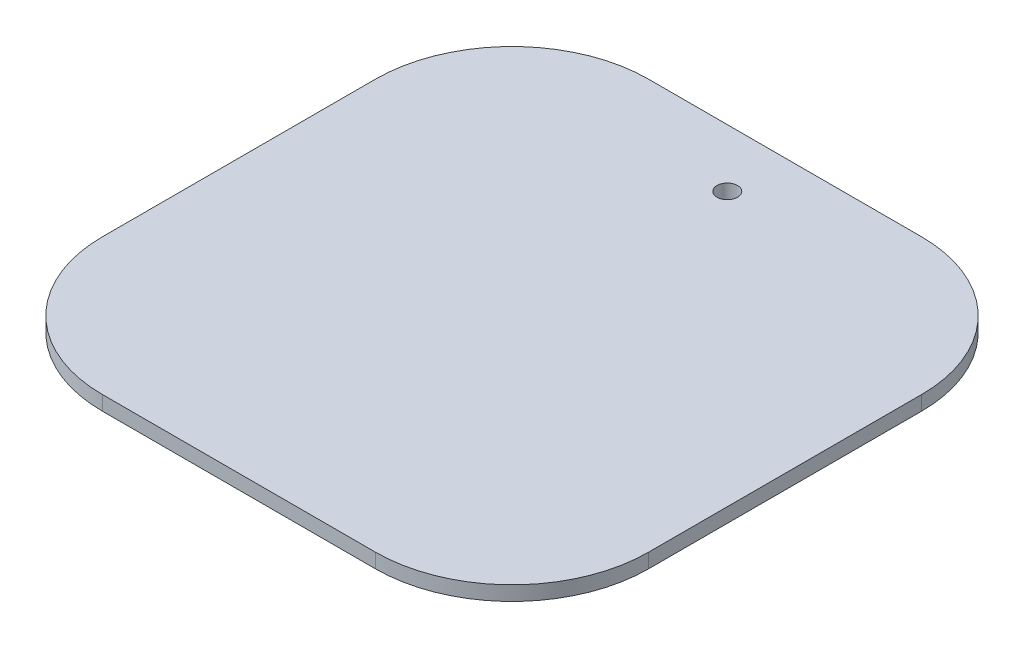
from build123d import *

# Parameters (mm, degrees)
BOSS_EXTRUDE1_DEPTH      = 3.175
M4_CLEARANCE_HOLE1_D     = 4.5
M4_CLEARANCE_HOLE1_DEPTH = 50
M4_CLEARANCE_HOLE1_TIP   = 1.351936393


with BuildPart() as part:
    # Sketch1 → Boss-Extrude1 (new body)
    with BuildSketch(Plane(origin=(0, 0, 0), x_dir=(1, 0, 0), z_dir=(0, 1, 0))):
        with BuildLine():
            Line((-30, 60), (30, 60))
            ThreePointArc((30, 60), (51.213203436, 51.213203436), (60, 30))
            Line((60, 30), (60, -30))
            ThreePointArc((60, -30), (51.213203436, -51.213203436), (30, -60))
            Line((30, -60), (-30, -60))
            ThreePointArc((-30, -60), (-51.213203436, -51.213203436), (-60, -30))
            Line((-60, -30), (-60, 30))
            ThreePointArc((-60, 30), (-51.213203436, 51.213203436), (-30, 60))
        make_face()
    extrude(amount=BOSS_EXTRUDE1_DEPTH)

    # M4 Clearance Hole1
    with Locations(Plane(origin=(0, 3.175, 0), x_dir=(1, 0, 0), z_dir=(0, 1, 0))):
        with Locations((0, 47.3)):
            Hole(M4_CLEARANCE_HOLE1_D / 2, depth=M4_CLEARANCE_HOLE1_DEPTH)
            with Locations((0, 0, -(M4_CLEARANCE_HOLE1_DEPTH + M4_CLEARANCE_HOLE1_TIP / 2))):  # 118° drill point
                Cone(0, M4_CLEARANCE_HOLE1_D / 2, M4_CLEARANCE_HOLE1_TIP, mode=Mode.SUBTRACT)


solid = part.part
